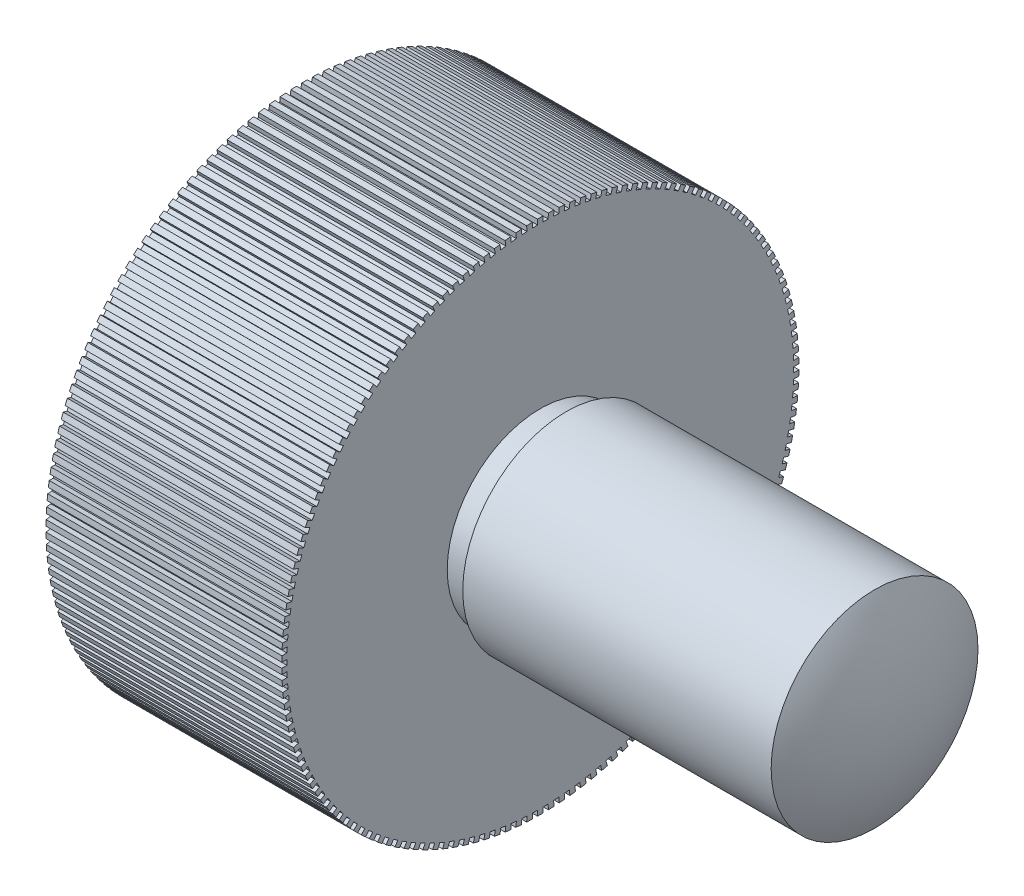
from build123d import *

# Parameters (mm, degrees)
SKETCH_2_OUTSIDE_W       = 185.036
SKETCH_2_OUTSIDE_H       = 185.036
SKETCH_2_OUTSIDE_R       = 2.5
CUT_EXTRUDE_1_DEPTH      = 14.928388277
CUT_EXTRUDE_1_DRAFT      = -80
CUT_EXTRUDE_2_DEPTH      = 10.949874371
PATTERN_CIRCULAR_1_COUNT = 150


with BuildPart() as part:
    # 草图1 → 旋转1 (revolve)
    with BuildSketch(Plane.XY):
        with BuildLine():
            Line((0, 5), (0, 0))
            Line((0, 0), (12, 0))
            ThreePointArc((12, 0), (11.863703305, 1.03527618), (11.464101615, 2))
            Line((11.464101615, 2), (5.5, 2))
            Line((5.5, 2), (5.5, 1.8))
            Line((5.5, 1.8), (5, 1.8))
            Line((5, 1.8), (5, 5))
            Line((5, 5), (0, 5))
        make_face()
    revolve(axis=Axis((0, 0, 0), (1, 0, 0)))


with BuildPart() as cut_extrude_1_tool:
    # 草图2 outside → 切除-拉伸1 (with draft: the straight prism first)
    with BuildSketch(Plane.ZY):
        Rectangle(SKETCH_2_OUTSIDE_W, SKETCH_2_OUTSIDE_H)
        Circle(SKETCH_2_OUTSIDE_R, mode=Mode.SUBTRACT)
    extrude(amount=-CUT_EXTRUDE_1_DEPTH)
    # 切除-拉伸1: the draft: its side faces are tilted about the plane it starts from
    cut_extrude_1_sides = [cut_extrude_1_tool.faces().sort_by_distance(p)[0] for p in [
        (7.464194139, -92.518, 0),
        (7.464194139, 0, 92.518),
        (7.464194139, 92.518, 0),
        (7.464194139, 0, -92.518),
        (7.464194139, 0, -2.5),
    ]]
    draft(cut_extrude_1_sides, Plane.ZY, CUT_EXTRUDE_1_DRAFT)


with BuildPart() as part_1:
    add(part.part)

    # 切除-拉伸1: cut by cut_extrude_1_tool
    add(cut_extrude_1_tool.part, mode=Mode.SUBTRACT)

    # 草图3 → 切除-拉伸2 (cut, through all)
    with BuildSketch(Plane(origin=(5, 0, 0), x_dir=(0, 0, -1), z_dir=(1, 0, 0))):
        with BuildLine():
            Line((4.899744891, -0.05), (6.59574948, -0.05))
            Line((6.59574948, -0.05), (6.59574948, 0.05))
            Line((6.59574948, 0.05), (4.899744891, 0.05))
            ThreePointArc((4.899744891, 0.05), (4.9, 0), (4.899744891, -0.05))
        make_face()
    cut_extrude_2 = extrude(amount=-CUT_EXTRUDE_2_DEPTH, mode=Mode.SUBTRACT)

    # 阵列(圆周)1: 切除-拉伸2 ×150 about axis
    pattern_circular_1_axis = Axis((0, 0, 0), (-1, 0, 0))
    for i in range(1, PATTERN_CIRCULAR_1_COUNT):
        add(cut_extrude_2.rotate(pattern_circular_1_axis, i * 360 / PATTERN_CIRCULAR_1_COUNT), mode=Mode.SUBTRACT)


solid = part_1.part
